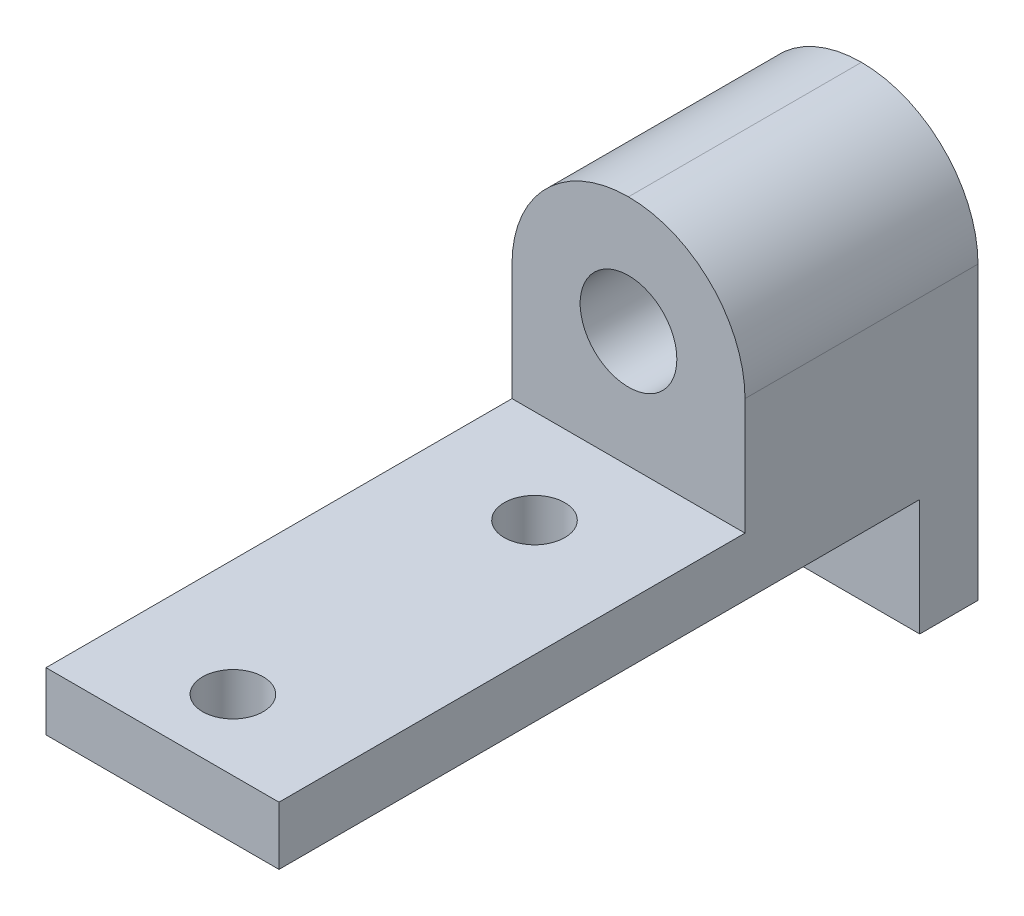
from build123d import *

# Parameters (mm, degrees)
SKETCH_1_W          = 20
SKETCH_1_H          = 40
EXTRUDE_1_DEPTH     = 5
SKETCH_2_W          = 20
SKETCH_2_H          = 20
EXTRUDE_2_DEPTH     = 20
SKETCH_3_R          = 4.15
CUT_EXTRUDE_1_DEPTH = 42.044142746
FILLET_1_R          = 10
SKETCH_6_W          = 20
SKETCH_6_H          = 25.791536141
CUT_EXTRUDE_3_DEPTH = 54.65112416
SKETCH_7_W          = 20
SKETCH_7_H          = 5
EXTRUDE_5_DEPTH     = 10
SKETCH_8_W          = 20
SKETCH_8_H          = 5
EXTRUDE_6_DEPTH     = 10
SKETCH_10_R         = 1.6
CUT_EXTRUDE_5_DEPTH = 45.828803841
SKETCH_11_W         = 20
SKETCH_11_H         = 5
EXTRUDE_7_DEPTH     = 20
SKETCH_12_R         = 2.6
CUT_EXTRUDE_7_DEPTH = 82.655934826


with BuildPart() as part:
    # 草图1 → 凸台-拉伸1 (new body)
    with BuildSketch(Plane(origin=(0, 0, 0), x_dir=(1, 0, 0), z_dir=(0, 1, 0))):
        with Locations((2.634146341, -28.154142811)):
            Rectangle(SKETCH_1_W, SKETCH_1_H)
    extrude(amount=EXTRUDE_1_DEPTH)

    # 草图2 → 凸台-拉伸2 (add)
    with BuildSketch(Plane(origin=(0, 5, 0), x_dir=(1, 0, 0), z_dir=(0, 1, 0))):
        with Locations((2.634146341, -28.154142811)):
            Rectangle(SKETCH_2_W, SKETCH_2_H)
    extrude(amount=EXTRUDE_2_DEPTH)

    # 草图3 → 切除-拉伸1 (cut, through all)
    with BuildSketch(Plane.XY.offset(38.154142811)):
        with Locations((2.634146341, 15)):
            Circle(SKETCH_3_R)
    extrude(amount=-CUT_EXTRUDE_1_DEPTH, mode=Mode.SUBTRACT)

    # 圆角1
    fillet_1_edges = [part.edges().sort_by_distance(p)[0] for p in [
        (12.634146341, 25, 28.154142811),
        (-7.365853659, 25, 28.154142811),
    ]]
    fillet(fillet_1_edges, radius=FILLET_1_R - 0.0001)  # a hair under: the kernel refuses the full size

    # 草图6 → 切除-拉伸3 (cut, through all)
    with BuildSketch(Plane(origin=(0, 5, 0), x_dir=(1, 0, 0), z_dir=(0, 1, 0))):
        with Locations((2.634146341, -5.25837474)):
            Rectangle(SKETCH_6_W, SKETCH_6_H)
    extrude(amount=-CUT_EXTRUDE_3_DEPTH, mode=Mode.SUBTRACT)

    # 草图7 → 凸台-拉伸5 (add)
    with BuildSketch(Plane.XZ):
        with Locations((2.634146341, 20.654142811)):
            Rectangle(SKETCH_7_W, SKETCH_7_H)
    extrude(amount=EXTRUDE_5_DEPTH)

    # 草图8 → 凸台-拉伸6 (add)
    with BuildSketch(Plane.XY.offset(48.154142811)):
        with Locations((2.634146341, 2.5)):
            Rectangle(SKETCH_8_W, SKETCH_8_H)
    extrude(amount=EXTRUDE_6_DEPTH)

    # 草图10 → 切除-拉伸5 (cut, through all)
    with BuildSketch(Plane.XY.offset(23.154142811)):
        with Locations((2.634146341, -5)):
            Circle(SKETCH_10_R)
    extrude(amount=-CUT_EXTRUDE_5_DEPTH, mode=Mode.SUBTRACT)

    # 草图11 → 凸台-拉伸7 (add)
    with BuildSketch(Plane.XY.offset(58.154142811)):
        with Locations((2.634146341, 2.5)):
            Rectangle(SKETCH_11_W, SKETCH_11_H)
    extrude(amount=EXTRUDE_7_DEPTH)

    # 草图12 → 切除-拉伸7 (cut, through all)
    with BuildSketch(Plane(origin=(0, 5, 0), x_dir=(1, 0, 0), z_dir=(0, 1, 0))):
        with Locations(Location((2.634146341, -46.221727325, 0), (0, 0, 270))):
            Circle(SKETCH_12_R)
        with Locations(Location((2.634146341, -72.110167443, 0), (0, 0, 270))):
            Circle(SKETCH_12_R)
    extrude(amount=-CUT_EXTRUDE_7_DEPTH, mode=Mode.SUBTRACT)


solid = part.part
